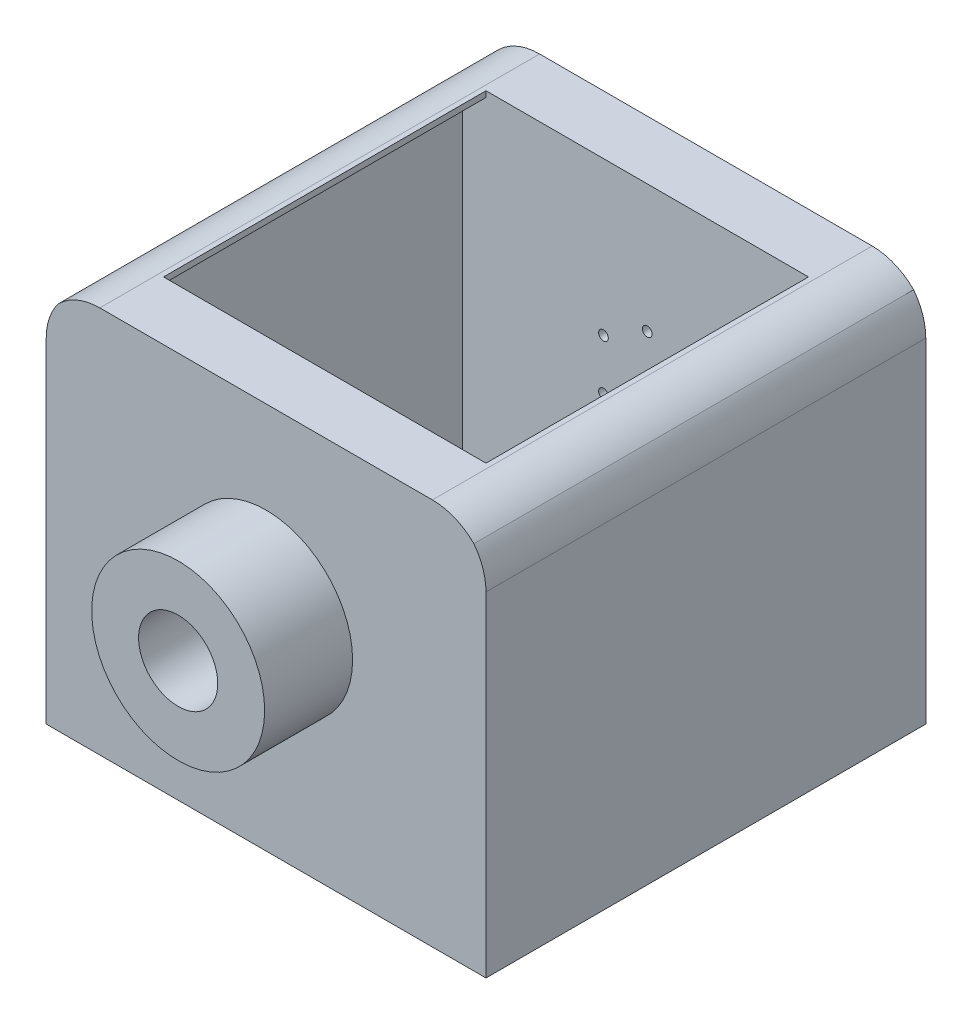
from build123d import *

# Parameters (mm, degrees)
EXTRUDE_1_OUTLINE_W             = 150
EXTRUDE_1_OUTLINE_H             = 400
EXTRUDE_1_OUTLINE_R             = 48.25
EXTRUDE_1_DEPTH                 = 20
SKETCH_2_W                      = 150
SKETCH_2_H                      = 400
SKETCH_2_W_2                    = 126
SKETCH_2_H_2                    = 376
EXTRUDE_1_2_DEPTH               = 110
EXTRUDE_START                   = 20
SKETCH_3_W                      = 150
SKETCH_3_H                      = 400
SKETCH_3_R                      = 48.25
EXTRUDE_3_DEPTH                 = 20
SKETCH_4_W                      = 110
SKETCH_4_H                      = 55
CUT_EXTRUDE_1_DEPTH             = 428.229446551
CHAMFER_2_SIZE                  = 20
CHAMFER_3_SIZE                  = 20
CUT_EXTRUDE_START               = 190
CUT_EXTRUDE_2_OUTLINE_W         = 132
CUT_EXTRUDE_2_OUTLINE_H         = 152
CUT_EXTRUDE_2_DEPTH             = 10
FILLET_1_R                      = 20
FILLET_2_R                      = 20
FILLET_3_R                      = 20
FILLET_4_R                      = 20
EXTRUDE_START_2                 = -20
SKETCH_6_R                      = 48.25
SKETCH_6_R_2                    = 29.5
EXTRUDE_4_DEPTH                 = 20
SKETCH_7_R                      = 48.25
SKETCH_7_R_2                    = 29.5
EXTRUDE_5_DEPTH                 = 20
SKETCH_8_R                      = 29.5
EXTRUDE_7_DEPTH                 = 20
SKETCH_9_R                      = 29.5
EXTRUDE_8_DEPTH                 = 20
SKETCH_10_R                     = 1.65
EXTRUDE_9_DEPTH                 = 10
EXTRUDE_START_3                 = 10
SKETCH_11_R                     = 1.65
EXTRUDE_10_DEPTH                = 10
SKETCH_12_W                     = 110
SKETCH_12_H                     = 147.914448675
CUT_EXTRUDE_3_DEPTH             = 287.530975638
CHAMFER_4_SIZE                  = 10
CHAMFER_5_SIZE                  = 10
SKETCH_13_W                     = 150
SKETCH_13_H                     = 80
CUT_EXTRUDE_4_DEPTH             = 267.880122902
SKETCH_15_R                     = 29.5
SKETCH_15_R_2                   = 13.5
EXTRUDE_11_DEPTH                = 30
CUT_EXTRUDE_5_REACH             = 274.259
SKETCH_16_R                     = 1.65
CUT_EXTRUDE_5_DIRECTION_2_DEPTH = 273.259067801


with BuildPart() as part:
    # Extrude 1: read off the stored shape, not the designer's step
    # Extrude 1 outline → Extrude 1 (new body)
    with BuildSketch(Plane.XY):
        Rectangle(EXTRUDE_1_OUTLINE_W, EXTRUDE_1_OUTLINE_H)
        with Locations((2.655190842, -130.335551325)):
            Circle(EXTRUDE_1_OUTLINE_R, mode=Mode.SUBTRACT)
        with Locations((0, 129.13990983)):
            Circle(EXTRUDE_1_OUTLINE_R, mode=Mode.SUBTRACT)
    extrude(amount=EXTRUDE_1_DEPTH)

    # 草图2 → Extrude 1 2 (add)
    with BuildSketch(Plane(origin=(0, 0, 0), x_dir=(-1, 0, 0), z_dir=(0, 0, -1))):
        Rectangle(SKETCH_2_W, SKETCH_2_H)
        Rectangle(SKETCH_2_W_2, SKETCH_2_H_2, mode=Mode.SUBTRACT)
    extrude(amount=EXTRUDE_1_2_DEPTH)

    # 草图3 → 凸台-拉伸3 (add)
    with BuildSketch(Plane(origin=(0, 0, -110), x_dir=(-1, 0, 0), z_dir=(0, 0, -1)).offset(EXTRUDE_START)):
        Rectangle(SKETCH_3_W, SKETCH_3_H)
        with Locations(Location((-2.655190842, -130.335551325, 0), (0, 0, 180))):
            Circle(SKETCH_3_R, mode=Mode.SUBTRACT)
        with Locations(Location((0, 129.13990983, 0), (0, 0, 180))):
            Circle(SKETCH_3_R, mode=Mode.SUBTRACT)
    extrude(amount=-EXTRUDE_3_DEPTH)

    # 草图4 → 切除-拉伸1 (cut, through all)
    with BuildSketch(Plane.XZ.offset(200)):
        with Locations((0, -27.5)):
            Rectangle(SKETCH_4_W, SKETCH_4_H)
        with Locations((0, -82.5)):
            Rectangle(SKETCH_4_W, SKETCH_4_H)
    extrude(amount=-CUT_EXTRUDE_1_DEPTH, mode=Mode.SUBTRACT)

    # 倒角2
    chamfer_2_edges = [part.edges().sort_by_distance(p)[0] for p in [
        (-75, 200, -55),
    ]]
    chamfer(chamfer_2_edges, length=CHAMFER_2_SIZE - 0.0001)  # a hair under: the kernel refuses the full size

    # 倒角3
    chamfer_3_edges = [part.edges().sort_by_distance(p)[0] for p in [
        (75, 200, -55),
    ]]
    chamfer(chamfer_3_edges, length=CHAMFER_3_SIZE - 0.0001)  # a hair under: the kernel refuses the full size

    # 切除-拉伸2: read off the stored shape, not the designer's step
    # 切除-拉伸2 outline → 切除-拉伸2 (cut)
    with BuildSketch(Plane(origin=(0, 0, 0), x_dir=(1, 0, 0), z_dir=(0, 1, 0)).offset(CUT_EXTRUDE_START)):
        with Locations((0, 55)):
            Rectangle(CUT_EXTRUDE_2_OUTLINE_W, CUT_EXTRUDE_2_OUTLINE_H)
    extrude(amount=CUT_EXTRUDE_2_DEPTH, mode=Mode.SUBTRACT)

    # 圆角1
    fillet_1_edges = [part.edges().sort_by_distance(p)[0] for p in [
        (-65.0001, 190, -55),
    ]]
    fillet(fillet_1_edges, radius=FILLET_1_R)

    # 圆角2
    fillet_2_edges = [part.edges().sort_by_distance(p)[0] for p in [
        (65.0001, 190, -55),
    ]]
    fillet(fillet_2_edges, radius=FILLET_2_R)

    # 圆角3
    # the kernel refuses this fillet: 20 mm, written as the material it takes off along each edge
    with BuildSketch(Plane(origin=(-75, 180.0001, 40.112615753), x_dir=(0.7071067811865488, 0.7071067811865464, 0), z_dir=(0, 0, -1))) as fillet_3_piece_1:
        with BuildLine():
            CenterArc((8.453428829, 19.830842418), FILLET_3_R, 225, 37.542814558)
            Line((-5.688706794, 5.688706794), (-5.971549507, 5.405864082))
            Line((-5.971549507, 5.405864082), (-0.282842712, -0.282842712))
            Line((-0.282842712, -0.282842712), (0, -0.4))
            ThreePointArc((0, -0.4), (2.928861477, -0.4), (5.805808837, -0.396616848))
            Line((5.805808837, -0.396616848), (5.857722955, 0))
        make_face()
    extrude(amount=190.225231505, mode=Mode.SUBTRACT)

    # 圆角4
    # the kernel refuses this fillet: 20 mm, written as the material it takes off along each edge
    with BuildSketch(Plane(origin=(75, 180.0001, -150.112615753), x_dir=(-0.7071067811865438, 0.7071067811865511, 0), z_dir=(0, 0, 1))) as fillet_4_piece_1:
        with BuildLine():
            CenterArc((8.453428829, 19.830842418), FILLET_4_R, 225, 37.542814558)
            Line((-5.688706794, 5.688706794), (-5.971549507, 5.405864082))
            Line((-5.971549507, 5.405864082), (-0.282842712, -0.282842712))
            Line((-0.282842712, -0.282842712), (0, -0.4))
            ThreePointArc((0, -0.4), (2.928861477, -0.4), (5.805808837, -0.396616848))
            Line((5.805808837, -0.396616848), (5.857722955, 0))
        make_face()
    extrude(amount=190.225231505, mode=Mode.SUBTRACT)

    # 草图6 → 凸台-拉伸4 (add)
    with BuildSketch(Plane.XY.offset(20).offset(EXTRUDE_START_2)):
        with Locations(Location((0, 129.13990983, 0), (0, 0, 180))):
            Circle(SKETCH_6_R)
        with Locations((0, 129.13990983)):
            Circle(SKETCH_6_R_2, mode=Mode.SUBTRACT)
    extrude(amount=EXTRUDE_4_DEPTH)

    # 草图7 → 凸台-拉伸5 (add)
    with BuildSketch(Plane(origin=(0, 0, -130), x_dir=(-1, 0, 0), z_dir=(0, 0, -1))):
        with Locations((0, 129.13990983)):
            Circle(SKETCH_7_R)
        with Locations(Location((0, 129.13990983, 0), (0, 0, 180))):
            Circle(SKETCH_7_R_2, mode=Mode.SUBTRACT)
    extrude(amount=-EXTRUDE_5_DEPTH)

    # 草图8 → 凸台-拉伸7 (add)
    with BuildSketch(Plane.XY.offset(20).offset(EXTRUDE_START_2)):
        with Locations(Location((0, 129.13990983, 0), (0, 0, 180))):
            Circle(SKETCH_8_R)
    extrude(amount=EXTRUDE_7_DEPTH)

    # 草图9 → 凸台-拉伸8 (add)
    with BuildSketch(Plane(origin=(0, 0, -130), x_dir=(-1, 0, 0), z_dir=(0, 0, -1))):
        with Locations((0, 129.13990983)):
            Circle(SKETCH_9_R)
    extrude(amount=-EXTRUDE_8_DEPTH)

    # 草图10 → 凸台-拉伸9 (add)
    with BuildSketch(Plane(origin=(0, 0, -130), x_dir=(-1, 0, 0), z_dir=(0, 0, -1))):
        with Locations((0, 146.38990983)):
            Circle(SKETCH_10_R)
        with Locations((14.938938215, 137.76490983)):
            Circle(SKETCH_10_R)
        with Locations((14.938938215, 120.51490983)):
            Circle(SKETCH_10_R)
        with Locations((0, 111.88990983)):
            Circle(SKETCH_10_R)
        with Locations((-14.938938215, 120.51490983)):
            Circle(SKETCH_10_R)
        with Locations((-14.938938215, 137.76490983)):
            Circle(SKETCH_10_R)
    extrude(amount=EXTRUDE_9_DEPTH)

    # 草图11 → 凸台-拉伸10 (add)
    with BuildSketch(Plane.XY.offset(20).offset(EXTRUDE_START_3)):
        with Locations(Location((-14.938938215, 137.76490983, 0), (0, 0, 180))):
            Circle(SKETCH_11_R)
        with Locations(Location((-14.938938215, 120.51490983, 0), (0, 0, 180))):
            Circle(SKETCH_11_R)
        with Locations(Location((0, 111.88990983, 0), (0, 0, 180))):
            Circle(SKETCH_11_R)
        with Locations(Location((14.938938215, 120.51490983, 0), (0, 0, 180))):
            Circle(SKETCH_11_R)
        with Locations(Location((0, 146.38990983, 0), (0, 0, 180))):
            Circle(SKETCH_11_R)
        with Locations(Location((14.938938215, 137.76490983, 0), (0, 0, 180))):
            Circle(SKETCH_11_R)
    extrude(amount=-EXTRUDE_10_DEPTH)

    # 草图12 → 切除-拉伸3 (cut, through all)
    with BuildSketch(Plane.ZY.offset(75)):
        with Locations((-55, -126.042775663)):
            Rectangle(SKETCH_12_W, SKETCH_12_H)
    extrude(amount=-CUT_EXTRUDE_3_DEPTH, mode=Mode.SUBTRACT)

    # 倒角4
    chamfer_4_edges = [part.edges().sort_by_distance(p)[0] for p in [
        (-75, -200, -120),
    ]]
    chamfer(chamfer_4_edges, length=CHAMFER_4_SIZE)

    # 倒角5
    chamfer_5_edges = [part.edges().sort_by_distance(p)[0] for p in [
        (75, -200, -120),
        (-75, -200, 10),
        (75, -200, 10),
    ]]
    chamfer(chamfer_5_edges, length=CHAMFER_5_SIZE)

    # 草图13 → 切除-拉伸4 (cut, through all)
    with BuildSketch(Plane(origin=(0, 0, -130), x_dir=(-1, 0, 0), z_dir=(0, 0, -1))):
        with Locations((0, 17.914448675)):
            Rectangle(SKETCH_13_W, SKETCH_13_H)
    extrude(amount=-CUT_EXTRUDE_4_DEPTH, mode=Mode.SUBTRACT)


with BuildPart() as body_2:
    # of the pieces the cut leaves, the one that is kept (cut_extrude_4_keep)
    add(part.part.solids().sort_by_distance((63, 188, -110))[0])

    # 草图15 → 凸台-拉伸11 (add)
    with BuildSketch(Plane.XY.offset(20)):
        with Locations((0, 129.13990983)):
            Circle(SKETCH_15_R)
        with Locations((0, 129.13990983)):
            Circle(SKETCH_15_R_2, mode=Mode.SUBTRACT)
    extrude(amount=EXTRUDE_11_DEPTH)

    # 草图16 → 切除-拉伸5 (cut, up to next)
    with BuildSketch(Plane(origin=(0, 0, -130), x_dir=(-1, 0, 0), z_dir=(0, 0, -1)), mode=Mode.PRIVATE) as cut_extrude_5_sk1:
        with Locations((-14.938938215, 137.76490983)):
            Circle(SKETCH_16_R)
    cut_extrude_5_tool1 = extrude(cut_extrude_5_sk1.sketch, amount=-CUT_EXTRUDE_5_REACH, mode=Mode.PRIVATE) & body_2.part
    # 草图16 → 切除-拉伸5 (cut, up to next)
    with BuildSketch(Plane(origin=(0, 0, -130), x_dir=(-1, 0, 0), z_dir=(0, 0, -1)), mode=Mode.PRIVATE) as cut_extrude_5_sk2:
        with Locations((0, 146.38990983)):
            Circle(SKETCH_16_R)
    cut_extrude_5_tool2 = extrude(cut_extrude_5_sk2.sketch, amount=-CUT_EXTRUDE_5_REACH, mode=Mode.PRIVATE) & body_2.part
    # 草图16 → 切除-拉伸5 (cut, up to next)
    with BuildSketch(Plane(origin=(0, 0, -130), x_dir=(-1, 0, 0), z_dir=(0, 0, -1)), mode=Mode.PRIVATE) as cut_extrude_5_sk3:
        with Locations((14.938938215, 137.76490983)):
            Circle(SKETCH_16_R)
    cut_extrude_5_tool3 = extrude(cut_extrude_5_sk3.sketch, amount=-CUT_EXTRUDE_5_REACH, mode=Mode.PRIVATE) & body_2.part
    # 草图16 → 切除-拉伸5 (cut, up to next)
    with BuildSketch(Plane(origin=(0, 0, -130), x_dir=(-1, 0, 0), z_dir=(0, 0, -1)), mode=Mode.PRIVATE) as cut_extrude_5_sk4:
        with Locations((14.938938215, 120.51490983)):
            Circle(SKETCH_16_R)
    cut_extrude_5_tool4 = extrude(cut_extrude_5_sk4.sketch, amount=-CUT_EXTRUDE_5_REACH, mode=Mode.PRIVATE) & body_2.part
    # 草图16 → 切除-拉伸5 (cut, up to next)
    with BuildSketch(Plane(origin=(0, 0, -130), x_dir=(-1, 0, 0), z_dir=(0, 0, -1)), mode=Mode.PRIVATE) as cut_extrude_5_sk5:
        with Locations((0, 111.88990983)):
            Circle(SKETCH_16_R)
    cut_extrude_5_tool5 = extrude(cut_extrude_5_sk5.sketch, amount=-CUT_EXTRUDE_5_REACH, mode=Mode.PRIVATE) & body_2.part
    # 草图16 → 切除-拉伸5 (cut, up to next)
    with BuildSketch(Plane(origin=(0, 0, -130), x_dir=(-1, 0, 0), z_dir=(0, 0, -1)), mode=Mode.PRIVATE) as cut_extrude_5_sk6:
        with Locations((-14.938938215, 120.51490983)):
            Circle(SKETCH_16_R)
    cut_extrude_5_tool6 = extrude(cut_extrude_5_sk6.sketch, amount=-CUT_EXTRUDE_5_REACH, mode=Mode.PRIVATE) & body_2.part
    add(cut_extrude_5_tool1.solids().sort_by_distance((14.938938, 137.76491, -130))[0], mode=Mode.SUBTRACT)
    add(cut_extrude_5_tool2.solids().sort_by_distance((0, 146.38991, -130))[0], mode=Mode.SUBTRACT)
    add(cut_extrude_5_tool3.solids().sort_by_distance((-14.938938, 137.76491, -130))[0], mode=Mode.SUBTRACT)
    add(cut_extrude_5_tool4.solids().sort_by_distance((-14.938938, 120.51491, -130))[0], mode=Mode.SUBTRACT)
    add(cut_extrude_5_tool5.solids().sort_by_distance((0, 111.88991, -130))[0], mode=Mode.SUBTRACT)
    add(cut_extrude_5_tool6.solids().sort_by_distance((14.938938, 120.51491, -130))[0], mode=Mode.SUBTRACT)

    # 草图16 → 切除-拉伸5 direction 2 (cut)
    with BuildSketch(Plane(origin=(0, 0, -130), x_dir=(-1, 0, 0), z_dir=(0, 0, -1))):
        with Locations((-14.938938215, 137.76490983)):
            Circle(SKETCH_16_R)
        with Locations((0, 146.38990983)):
            Circle(SKETCH_16_R)
        with Locations((14.938938215, 137.76490983)):
            Circle(SKETCH_16_R)
        with Locations((14.938938215, 120.51490983)):
            Circle(SKETCH_16_R)
        with Locations((0, 111.88990983)):
            Circle(SKETCH_16_R)
        with Locations((-14.938938215, 120.51490983)):
            Circle(SKETCH_16_R)
    extrude(amount=CUT_EXTRUDE_5_DIRECTION_2_DEPTH, mode=Mode.SUBTRACT)


solid = body_2.part
